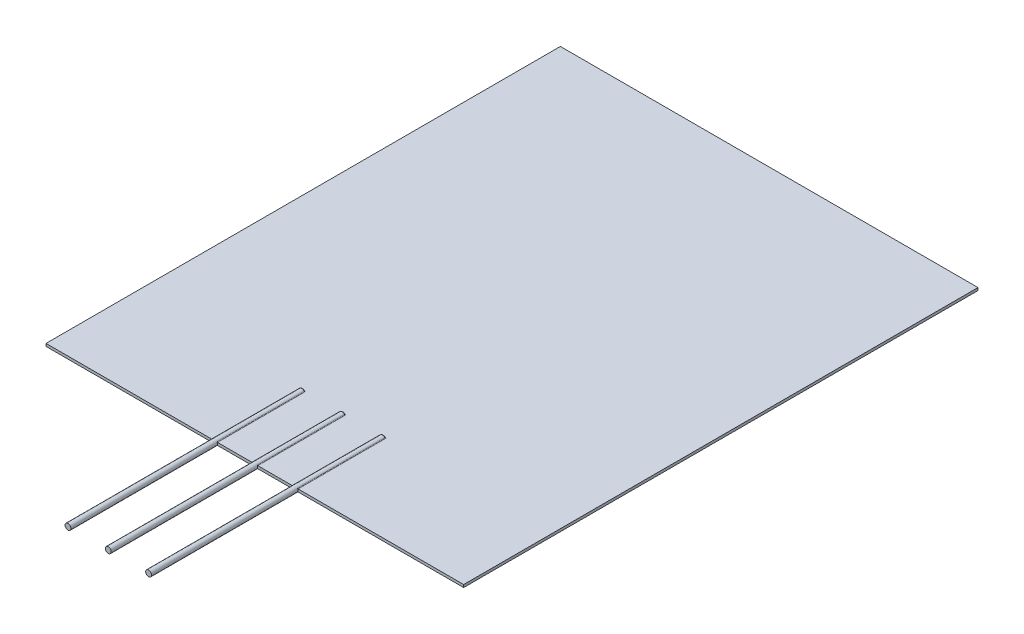
from build123d import *

# Parameters (mm, degrees)
SKETCH1_W                = 28.5
SKETCH1_H                = 35.1
BOSS_EXTRUDE1_DEPTH      = 0.18
BOSS_EXTRUDE2_DEPTH      = 10
BOSS_EXTRUDE2_DEPTH_BACK = 6
SKETCH2_R                = 0.2
FILLET1_R                = 0.05


with BuildPart() as part:
    # Sketch1 → Boss-Extrude1 (new body)
    with BuildSketch(Plane(origin=(0, 0, 0), x_dir=(1, 0, 0), z_dir=(0, 1, 0))):
        with Locations((14.25, 17.55)):
            Rectangle(SKETCH1_W, SKETCH1_H)
    extrude(amount=BOSS_EXTRUDE1_DEPTH)

    # Sketch2 → Boss-Extrude2 (add, two sides: drawn at the far end of the back side and taken through both)
    with BuildSketch(Plane.XY.offset(-BOSS_EXTRUDE2_DEPTH_BACK)):
        with Locations((14.25, 0.09)):
            Circle(SKETCH2_R)
        with Locations((17, 0.09)):
            Circle(SKETCH2_R)
        with Locations((11.5, 0.09)):
            Circle(SKETCH2_R)
    extrude(amount=BOSS_EXTRUDE2_DEPTH + BOSS_EXTRUDE2_DEPTH_BACK)

    # Fillet1
    fillet1_edges = [part.edges().sort_by_distance(p)[0] for p in [
        (11.5, -0.11, -6),
        (14.25, -0.11, -6),
        (17, -0.11, -6),
        (11.5, 0.29, -6),
        (17, 0.29, -6),
        (14.25, 0.29, -6),
    ]]
    fillet(fillet1_edges, radius=FILLET1_R)
    fillet1_2_edges = [part.edges().sort_by_distance(p)[0] for p in [
        (11.321394289, 0, -2.975),
        (11.678605711, 0, -2.975),
        (14.071394289, 0, -2.975),
        (14.428605711, 0, -2.975),
        (16.821394289, 0, -2.975),
        (17.178605711, 0, -2.975),
        (11.678605711, 0.18, -2.975),
        (11.321394289, 0.18, -2.975),
        (17.178605711, 0.18, -2.975),
        (16.821394289, 0.18, -2.975),
        (14.428605711, 0.18, -2.975),
        (14.071394289, 0.18, -2.975),
        (11.5, 0, -6),
        (14.25, 0, -6),
        (17, 0, -6),
        (11.5, 0.18, -6),
        (17, 0.18, -6),
        (14.25, 0.18, -6),
        (14.088189388, 0.18, -5.985553748),
        (14.411810612, 0.18, -5.985553748),
        (16.838189388, 0.18, -5.985553748),
        (17.161810612, 0.18, -5.985553748),
        (11.338189388, 0.18, -5.985553748),
        (11.661810612, 0.18, -5.985553748),
        (16.838189388, 0, -5.985553748),
        (17.161810612, 0, -5.985553748),
        (14.088189388, 0, -5.985553748),
        (14.411810612, 0, -5.985553748),
        (11.338189388, 0, -5.985553748),
        (11.661810612, 0, -5.985553748),
    ]]
    fillet(fillet1_2_edges, radius=FILLET1_R)


solid = part.part
